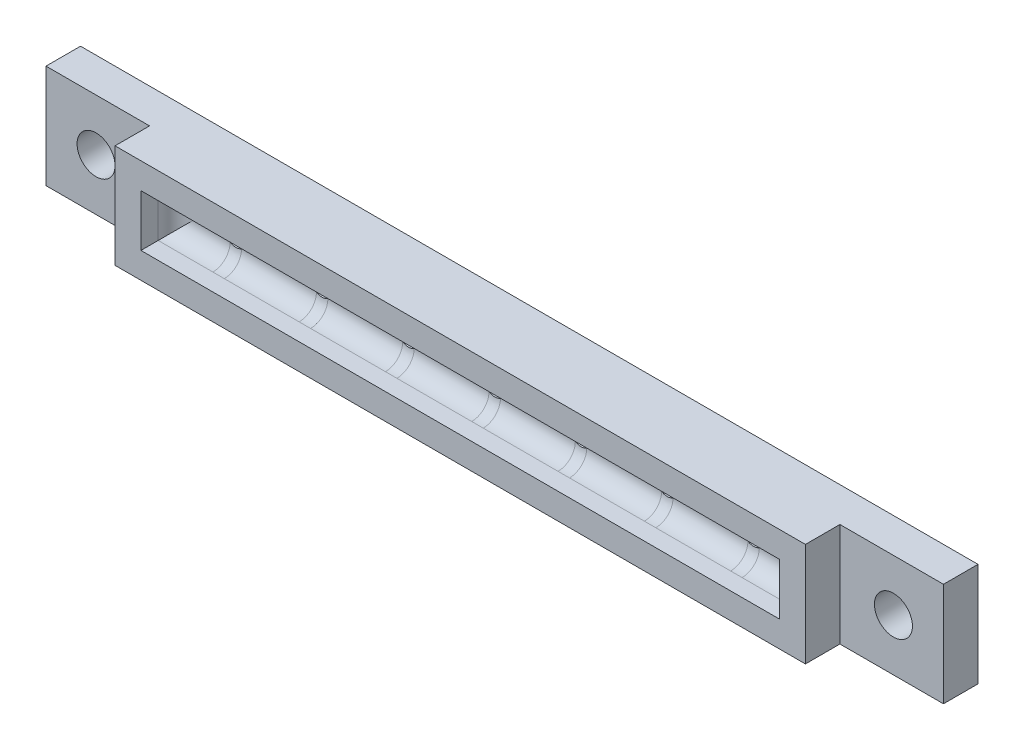
from build123d import *

# Parameters (mm, degrees)
SKETCH1_W           = 52
SKETCH1_H           = 6
BOSS_EXTRUDE1_DEPTH = 4
SKETCH2_W           = 6
SKETCH2_H           = 6
CUT_EXTRUDE1_DEPTH  = 2
SKETCH3_R           = 1.1
CUT_EXTRUDE2_DEPTH  = 2
SKETCH4_R           = 0.6
CUT_EXTRUDE3_DEPTH  = 30.07400668
SKETCH5_W           = 37
SKETCH5_H           = 3
CUT_EXTRUDE4_DEPTH  = 2
FILLET1_R           = 1


with BuildPart() as part:
    # Sketch1 → Boss-Extrude1 (new body)
    with BuildSketch(Plane.XY):
        with Locations((2.308411215, 2.285046729)):
            Rectangle(SKETCH1_W, SKETCH1_H)
    extrude(amount=BOSS_EXTRUDE1_DEPTH)

    # Sketch2 → Cut-Extrude1 (cut)
    with BuildSketch(Plane.XY.offset(4)):
        with Locations((-20.691588785, 2.285046729)):
            Rectangle(SKETCH2_W, SKETCH2_H)
        with Locations((25.308411215, 2.285046729)):
            Rectangle(SKETCH2_W, SKETCH2_H)
    extrude(amount=-CUT_EXTRUDE1_DEPTH, mode=Mode.SUBTRACT)

    # Sketch3 → Cut-Extrude2 (cut)
    with BuildSketch(Plane.XY.offset(2)):
        with Locations((25.408411215, 2.285046729)):
            Circle(SKETCH3_R)
        with Locations((-20.791588785, 2.285046729)):
            Circle(SKETCH3_R)
    extrude(amount=-CUT_EXTRUDE2_DEPTH, mode=Mode.SUBTRACT)

    # Sketch4 → Cut-Extrude3 (cut, through all)
    with BuildSketch(Plane.XY.offset(4)):
        with Locations((17.308411215, 2.285046729)):
            Circle(SKETCH4_R)
        with Locations((12.308411215, 2.285046729)):
            Circle(SKETCH4_R)
        with Locations((7.308411215, 2.285046729)):
            Circle(SKETCH4_R)
        with Locations((2.308411215, 2.285046729)):
            Circle(SKETCH4_R)
        with Locations((-2.691588785, 2.285046729)):
            Circle(SKETCH4_R)
        with Locations((-7.691588785, 2.285046729)):
            Circle(SKETCH4_R)
        with Locations((-12.691588785, 2.285046729)):
            Circle(SKETCH4_R)
    extrude(amount=-CUT_EXTRUDE3_DEPTH, mode=Mode.SUBTRACT)

    # Sketch5 → Cut-Extrude4 (cut)
    with BuildSketch(Plane.XY.offset(4)):
        with Locations((2.308411215, 2.285046729)):
            Rectangle(SKETCH5_W, SKETCH5_H)
    extrude(amount=-CUT_EXTRUDE4_DEPTH, mode=Mode.SUBTRACT)

    # Fillet1
    fillet1_edges = [part.edges().sort_by_distance(p)[0] for p in [
        (20.808411215, 2.285046729, 2),
        (2.308411215, 3.785046729, 2),
        (-16.191588785, 2.285046729, 2),
        (2.308411215, 0.785046729, 2),
    ]]
    fillet(fillet1_edges, radius=FILLET1_R)


solid = part.part
